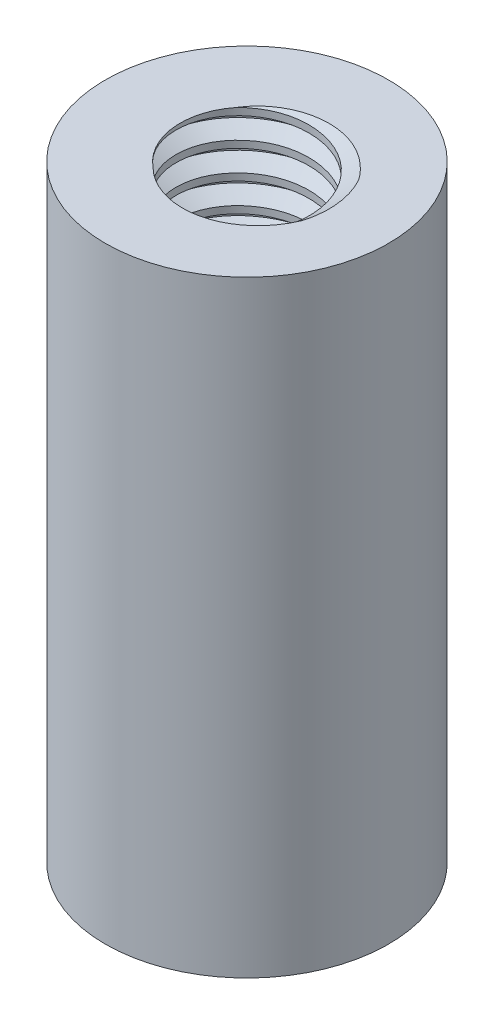
from build123d import *

# Parameters (mm, degrees)
SKETCH1_R           = 3.5
BOSS_EXTRUDE1_DEPTH = 7.5
SKETCH2_R           = 1.65
CUT_EXTRUDE1_DEPTH  = 6.5
THREAD1_PITCH       = 0.7
THREAD2_PITCH       = 0.7


with BuildPart() as part:
    # Sketch1 → Boss-Extrude1 (new, symmetric)
    with BuildSketch(Plane(origin=(0, 0, 0), x_dir=(1, 0, 0), z_dir=(0, 1, 0))):
        with Locations(Location((0, 0, 0), (0, 0, 270))):
            Circle(SKETCH1_R)
    extrude(amount=BOSS_EXTRUDE1_DEPTH, both=True)

    # Sketch2 → Cut-Extrude1 (cut)
    with BuildSketch(Plane(origin=(0, 7.5, 0), x_dir=(1, 0, 0), z_dir=(0, 1, 0))):
        with Locations(Location((0, 0, 0), (0, 0, 270))):
            Circle(SKETCH2_R)
    cut_extrude1 = extrude(amount=-CUT_EXTRUDE1_DEPTH, mode=Mode.SUBTRACT)

    # Thread1: the profile of Thread Profile1 profile screwed along a right-hand helix of 11.428571 turns, 6 arcs to a turn; built about Z, then put on its axis
    thread1_z = Axis((0, 0, 0), (0, 0, 1))
    thread1_corners = [(1.6497, 0, -0.000173205), (2.028886112, 0, 0.218749999), (2.028886112, 0, 0.306249999), (1.6497, 0, 0.525173203)]
    with BuildLine(mode=Mode.PRIVATE) as thread1_profile:
        Line(thread1_corners[0], thread1_corners[1])
        Line(thread1_corners[1], thread1_corners[2])
        Line(thread1_corners[2], thread1_corners[3])
        Line(thread1_corners[3], thread1_corners[0])
    thread1_cap = Face(thread1_profile.wire())
    thread1_turn_angles = [0, 30, 60, 90, 120, 150, 180, 210, 240, 270, 300, 330, 360]
    thread1_turn_weights = [1, 0.8660254037844387, 1, 0.8660254037844387, 1, 0.8660254037844387, 1, 0.8660254037844387, 1, 0.8660254037844387, 1, 0.8660254037844387, 1]
    thread1_turn_rails = [Edge.make_bspline([Vector(p[0], p[1], 0).rotate(thread1_z, thread1_turn_angles[k]) / thread1_turn_weights[k] + Vector(0, 0, p[2] + THREAD1_PITCH * thread1_turn_angles[k] / 360) for k in range(13)], [0, 0, 0, 1, 1, 2, 2, 3, 3, 4, 4, 5, 5, 6, 6, 6], 2, thread1_turn_weights) for p in thread1_corners]
    thread1_turn_sides = [Face.make_surface_from_curves(thread1_turn_rails[p[0]], thread1_turn_rails[p[1]]) for p in [(0, 1), (1, 2), (2, 3), (3, 0)]]
    thread1_last_angles = [3960, 3990, 4020, 4050, 4080, 4097.142857143, 4114.285714286]
    thread1_last_weights = [1, 0.8660254037844387, 1, 0.8660254037844387, 1, 0.9555728057861397, 1]
    thread1_last_rails = [Edge.make_bspline([Vector(p[0], p[1], 0).rotate(thread1_z, thread1_last_angles[k]) / thread1_last_weights[k] + Vector(0, 0, p[2] + THREAD1_PITCH * thread1_last_angles[k] / 360) for k in range(7)], [0, 0, 0, 1, 1, 2, 2, 3, 3, 3], 2, thread1_last_weights) for p in thread1_corners]
    thread1_last_sides = [Face.make_surface_from_curves(thread1_last_rails[p[0]], thread1_last_rails[p[1]]) for p in [(0, 1), (1, 2), (2, 3), (3, 0)]]
    thread1 = Plane(origin=(0, 9.5, 0), x_dir=(-1, 0, 0), z_dir=(0, -1, 0)) * Solid(Shell([*[p.moved(Location((0, 0, THREAD1_PITCH * i))) for i in range(11) for p in thread1_turn_sides], *thread1_last_sides, thread1_cap, thread1_cap.rotate(thread1_z, 4114.285714286).moved(Location((0, 0, THREAD1_PITCH * 4114.285714286 / 360)))]))
    add(thread1, mode=Mode.SUBTRACT)

    # Mirror3: Cut-Extrude1 across plane
    add(cut_extrude1.mirror(Plane.ZX), mode=Mode.SUBTRACT)

    # Thread2: the profile of Thread Profile2 profile screwed along a right-hand helix of 11.428571 turns, 6 arcs to a turn; built about Z, then put on its axis
    thread2_z = Axis((0, 0, 0), (0, 0, 1))
    thread2_corners = [(1.6497, 0, -0.000173205), (2.028886112, 0, 0.218749999), (2.028886112, 0, 0.306249999), (1.6497, 0, 0.525173203)]
    with BuildLine(mode=Mode.PRIVATE) as thread2_profile:
        Line(thread2_corners[0], thread2_corners[1])
        Line(thread2_corners[1], thread2_corners[2])
        Line(thread2_corners[2], thread2_corners[3])
        Line(thread2_corners[3], thread2_corners[0])
    thread2_cap = Face(thread2_profile.wire())
    thread2_turn_angles = [0, 30, 60, 90, 120, 150, 180, 210, 240, 270, 300, 330, 360]
    thread2_turn_weights = [1, 0.8660254037844387, 1, 0.8660254037844387, 1, 0.8660254037844387, 1, 0.8660254037844387, 1, 0.8660254037844387, 1, 0.8660254037844387, 1]
    thread2_turn_rails = [Edge.make_bspline([Vector(p[0], p[1], 0).rotate(thread2_z, thread2_turn_angles[k]) / thread2_turn_weights[k] + Vector(0, 0, p[2] + THREAD2_PITCH * thread2_turn_angles[k] / 360) for k in range(13)], [0, 0, 0, 1, 1, 2, 2, 3, 3, 4, 4, 5, 5, 6, 6, 6], 2, thread2_turn_weights) for p in thread2_corners]
    thread2_turn_sides = [Face.make_surface_from_curves(thread2_turn_rails[p[0]], thread2_turn_rails[p[1]]) for p in [(0, 1), (1, 2), (2, 3), (3, 0)]]
    thread2_last_angles = [3960, 3990, 4020, 4050, 4080, 4097.142857143, 4114.285714286]
    thread2_last_weights = [1, 0.8660254037844387, 1, 0.8660254037844387, 1, 0.9555728057861397, 1]
    thread2_last_rails = [Edge.make_bspline([Vector(p[0], p[1], 0).rotate(thread2_z, thread2_last_angles[k]) / thread2_last_weights[k] + Vector(0, 0, p[2] + THREAD2_PITCH * thread2_last_angles[k] / 360) for k in range(7)], [0, 0, 0, 1, 1, 2, 2, 3, 3, 3], 2, thread2_last_weights) for p in thread2_corners]
    thread2_last_sides = [Face.make_surface_from_curves(thread2_last_rails[p[0]], thread2_last_rails[p[1]]) for p in [(0, 1), (1, 2), (2, 3), (3, 0)]]
    thread2 = Plane(origin=(0, -9.5, 0), x_dir=(1, 0, 0), z_dir=(0, 1, 0)) * Solid(Shell([*[p.moved(Location((0, 0, THREAD2_PITCH * i))) for i in range(11) for p in thread2_turn_sides], *thread2_last_sides, thread2_cap, thread2_cap.rotate(thread2_z, 4114.285714286).moved(Location((0, 0, THREAD2_PITCH * 4114.285714286 / 360)))]))
    add(thread2, mode=Mode.SUBTRACT)


solid = part.part
